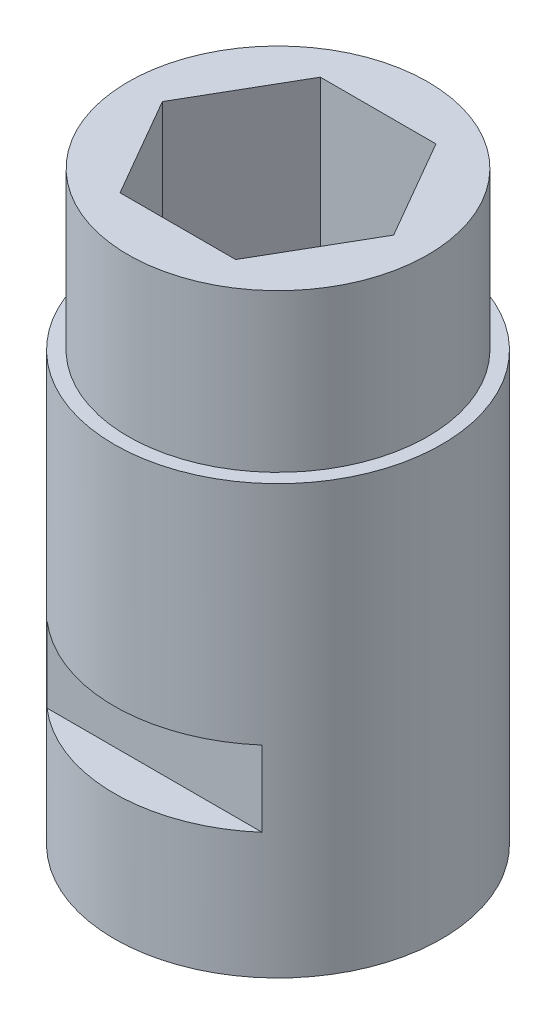
from build123d import *

# Parameters (mm, degrees)
SKETCH1_R               = 7.5565
BOSS_EXTRUDE1_DEPTH     = 28.88996
BOSS_EXTRUDE2_START     = 0.635
SKETCH2_R               = 7.5565
SKETCH2_R_2             = 3.3
BOSS_EXTRUDE2_DEPTH     = 0.635
SKETCH4_R               = 8.255
SKETCH4_R_2             = 7.5565
BOSS_EXTRUDE3_DEPTH     = 21.59
CUT_EXTRUDE1_DEPTH      = 32.159586628
CUT_EXTRUDE1_DEPTH_BACK = 32.159586628
SKETCH3_W               = 2.140633032
SKETCH3_H               = 3.81
SKETCH3_W_2             = 2.256055482


with BuildPart() as part:
    # Sketch1 → Boss-Extrude1 (new body)
    with BuildSketch(Plane(origin=(0, 0, 0), x_dir=(1, 0, 0), z_dir=(0, 1, 0))):
        Circle(SKETCH1_R)
        Polygon((-2.915618859, 5.05), (-5.831237719, 0), (-2.915618859, -5.05), (2.915618859, -5.05), (5.831237719, 0), (2.915618859, 5.05), align=None, mode=Mode.SUBTRACT)
    extrude(amount=BOSS_EXTRUDE1_DEPTH)

    # Sketch2 → Boss-Extrude2 (add)
    with BuildSketch(Plane.XZ.offset(BOSS_EXTRUDE2_START)):
        Circle(SKETCH2_R)
        Circle(SKETCH2_R_2, mode=Mode.SUBTRACT)
    extrude(amount=-BOSS_EXTRUDE2_DEPTH)

    # Sketch4 → Boss-Extrude3 (add)
    with BuildSketch(Plane.XZ.offset(0.635)):
        Circle(SKETCH4_R)
        Circle(SKETCH4_R_2, mode=Mode.SUBTRACT)
    extrude(amount=-BOSS_EXTRUDE3_DEPTH)

    # Sketch3 → Cut-Extrude1 (cut, two sides: drawn at the far end of the back side and taken through both)
    with BuildSketch(Plane(origin=(0, 0, 0), x_dir=(0, 0, -1), z_dir=(1, 0, 0)).offset(-CUT_EXTRUDE1_DEPTH_BACK)):
        with Locations((-7.293316516, 7.62)):
            Rectangle(SKETCH3_W, SKETCH3_H)
        with Locations((7.351027741, 7.62)):
            Rectangle(SKETCH3_W_2, SKETCH3_H)
    extrude(amount=CUT_EXTRUDE1_DEPTH + CUT_EXTRUDE1_DEPTH_BACK, mode=Mode.SUBTRACT)


solid = part.part
